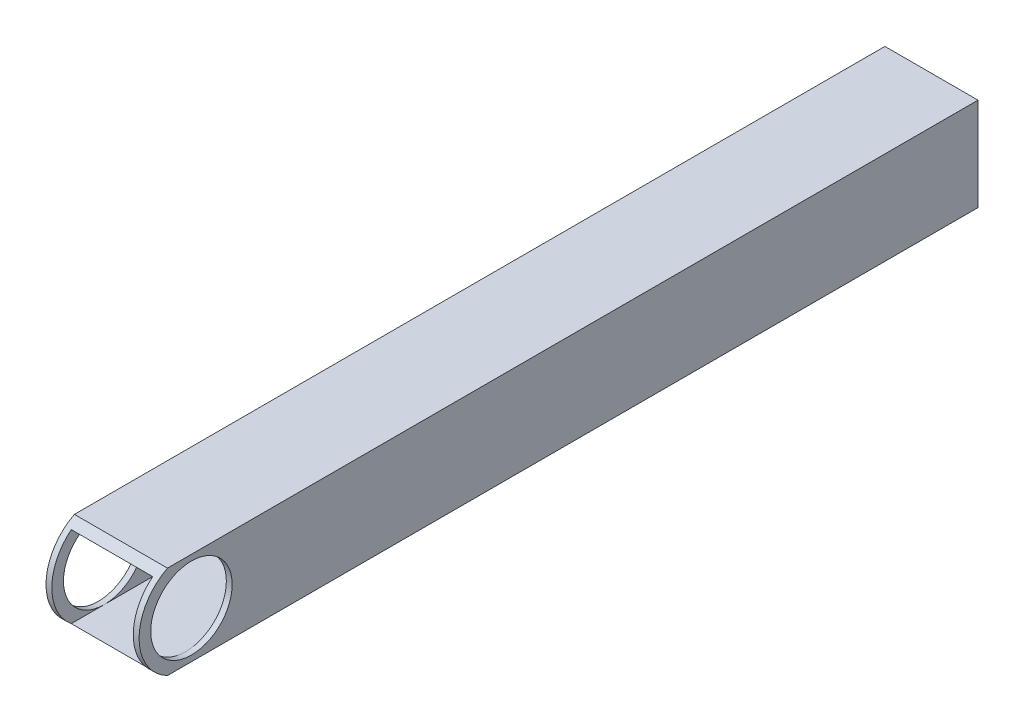
from build123d import *

# Parameters (mm, degrees)
SKETCH1_W           = 25.4
SKETCH1_H           = 25.4
SKETCH1_W_2         = 22.225
SKETCH1_H_2         = 22.225
EXTRUDE_THIN1_DEPTH = 116.84
SKETCH2_R           = 11.1125
CUT_EXTRUDE1_DEPTH  = 121.241571846
CUT_EXTRUDE2_DEPTH  = 121.241571846


with BuildPart() as part:
    # Sketch1 → Extrude-Thin1 (new, symmetric)
    with BuildSketch(Plane.XY):
        Rectangle(SKETCH1_W, SKETCH1_H)
        Rectangle(SKETCH1_W_2, SKETCH1_H_2, mode=Mode.SUBTRACT)
    extrude(amount=EXTRUDE_THIN1_DEPTH, both=True)

    # Sketch2 → Cut-Extrude1 (cut, through all)
    with BuildSketch(Plane(origin=(12.7, 0, 0), x_dir=(0, 0, -1), z_dir=(1, 0, 0))):
        with Locations((-97.79, 0)):
            Circle(SKETCH2_R)
    extrude(amount=-CUT_EXTRUDE1_DEPTH, mode=Mode.SUBTRACT)

    # Sketch3 → Cut-Extrude2 (cut, through all)
    with BuildSketch(Plane(origin=(12.7, 0, 0), x_dir=(0, 0, -1), z_dir=(1, 0, 0))):
        with BuildLine():
            Line((-97.79, 14.2875), (-116.84, 14.2875))
            Line((-116.84, 14.2875), (-116.84, -12.7))
            Line((-116.84, -12.7), (-104.335430181, -12.7))
            ThreePointArc((-104.335430181, -12.7), (-111.6749542, 3.367596045), (-97.79, 14.2875))
        make_face()
    extrude(amount=-CUT_EXTRUDE2_DEPTH, mode=Mode.SUBTRACT)


solid = part.part
